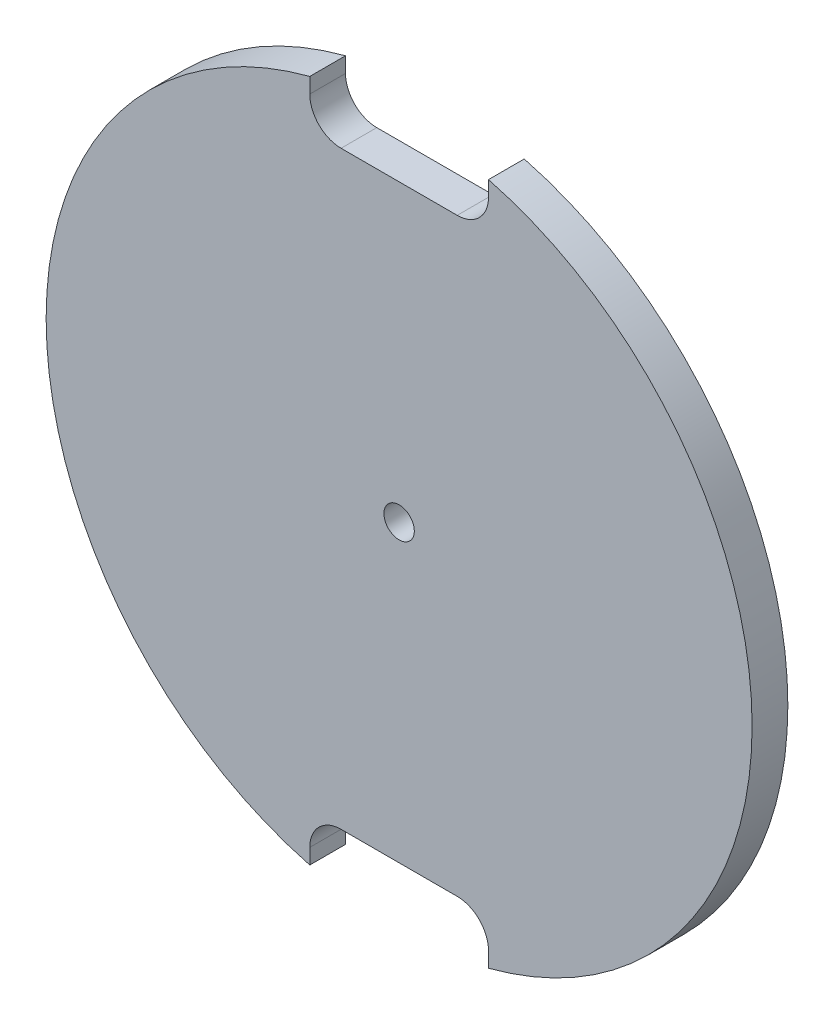
from build123d import *

# Parameters (mm, degrees)
SKETCH1_R           = 39.5
BOSS_EXTRUDE1_DEPTH = 4
CUT_EXTRUDE2_DEPTH  = 10
SKETCH7_R           = 26
BOSS_EXTRUDE2_DEPTH = 7
SKETCH8_R           = 1.7
CUT_EXTRUDE3_DEPTH  = 20
CUT_EXTRUDE4_START  = -7
SKETCH9_R           = 5
CUT_EXTRUDE4_DEPTH  = 20


with BuildPart() as part:
    # Sketch1 → Boss-Extrude1 (new body)
    with BuildSketch(Plane.XY):
        with Locations((-12.82554103, 19.238311544)):
            Circle(SKETCH1_R)
    extrude(amount=BOSS_EXTRUDE1_DEPTH)

    # Sketch5 → Cut-Extrude2 (cut)
    with BuildSketch(Plane.XY.offset(4)):
        with BuildLine():
            Line((-22.82554103, 60.183460186), (-22.82554103, 55.738311544))
            ThreePointArc((-22.82554103, 55.738311544), (-21.800414764, 53.26343781), (-19.32554103, 52.238311544))
            Line((-19.32554103, 52.238311544), (-6.32554103, 52.238311544))
            ThreePointArc((-6.32554103, 52.238311544), (-3.850667295, 53.26343781), (-2.82554103, 55.738311544))
            Line((-2.82554103, 55.738311544), (-2.82554103, 60.183460186))
            Line((-2.82554103, 60.183460186), (-22.82554103, 60.183460186))
        make_face()
        with BuildLine():
            Line((-6.32554103, -13.761688456), (-19.32554103, -13.761688456))
            ThreePointArc((-19.32554103, -13.761688456), (-21.800414764, -14.786814722), (-22.82554103, -17.261688456))
            Line((-22.82554103, -17.261688456), (-22.82554103, -22.058644266))
            Line((-22.82554103, -22.058644266), (-2.82554103, -22.058644266))
            Line((-2.82554103, -22.058644266), (-2.82554103, -17.261688456))
            ThreePointArc((-2.82554103, -17.261688456), (-3.850667295, -14.786814722), (-6.32554103, -13.761688456))
        make_face()
    extrude(amount=-CUT_EXTRUDE2_DEPTH, mode=Mode.SUBTRACT)

    # Sketch7 → Boss-Extrude2 (add)
    with BuildSketch(Plane(origin=(0, 0, 0), x_dir=(-1, 0, 0), z_dir=(0, 0, -1))):
        with Locations((12.82554103, 19.238311544)):
            Circle(SKETCH7_R)
    extrude(amount=BOSS_EXTRUDE2_DEPTH)

    # Sketch8 → Cut-Extrude3 (cut)
    with BuildSketch(Plane.XY.offset(4)):
        with Locations((-12.82554103, 19.238311544)):
            Circle(SKETCH8_R)
    extrude(amount=-CUT_EXTRUDE3_DEPTH, mode=Mode.SUBTRACT)

    # Sketch9 → Cut-Extrude4 (cut)
    with BuildSketch(Plane.XY.offset(4).offset(CUT_EXTRUDE4_START)):
        with Locations((-12.82554103, 19.238311544)):
            Circle(SKETCH9_R)
    extrude(amount=-CUT_EXTRUDE4_DEPTH, mode=Mode.SUBTRACT)


solid = part.part
